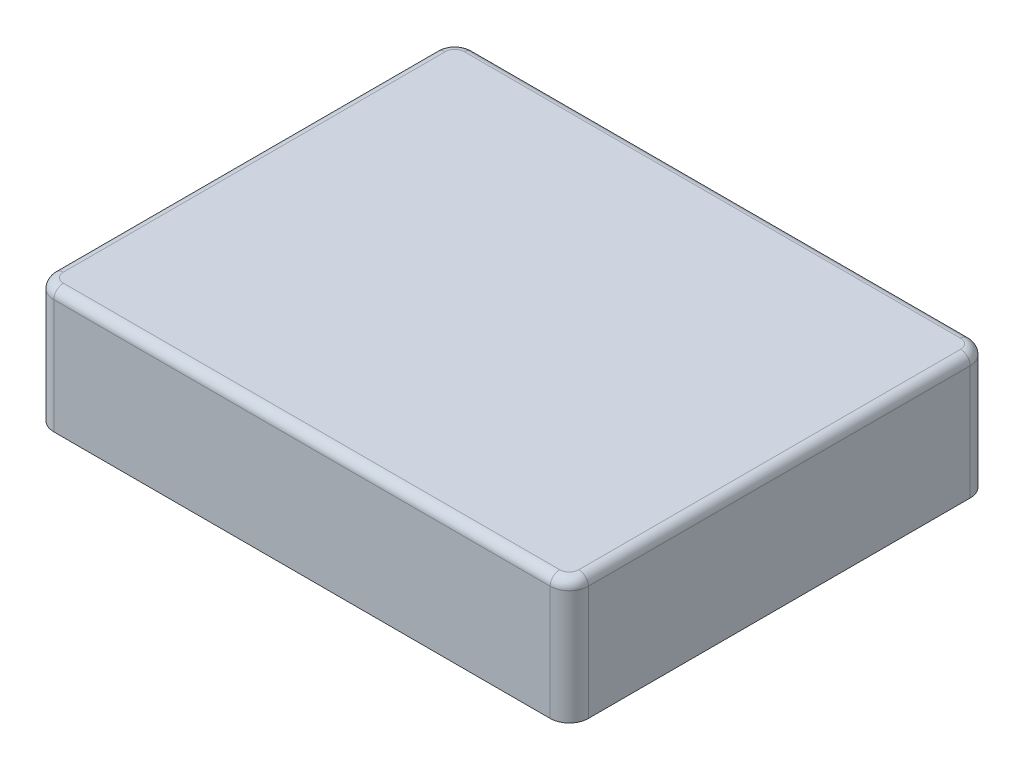
from build123d import *

# Parameters (mm, degrees)
SKETCH1_W           = 56
SKETCH1_H           = 44
BOSS_EXTRUDE1_DEPTH = 13
FILLET1_R           = 1
FILLET2_R           = 2


with BuildPart() as part:
    # Sketch1 → Boss-Extrude1 (new body)
    with BuildSketch(Plane(origin=(0, 0, 0), x_dir=(1, 0, 0), z_dir=(0, 1, 0))):
        Rectangle(SKETCH1_W, SKETCH1_H)
    extrude(amount=BOSS_EXTRUDE1_DEPTH)

    # Fillet1
    fillet1_edges = [part.edges().sort_by_distance(p)[0] for p in [
        (28, 13, 0),
        (0, 13, -22),
        (-28, 13, 0),
        (0, 13, 22),
    ]]
    fillet(fillet1_edges, radius=FILLET1_R)

    # Fillet2
    # the kernel refuses this fillet: 2 mm, written as the material it takes off along each edge
    with BuildSketch(Plane(origin=(26, 13, 20), x_dir=(0, 0, 1), z_dir=(-1, 0, 0))) as fillet2_piece_1:
        with BuildLine():
            CenterArc((1, -1), 1, 0, 90)
            Line((2, -1), (2, 0))
            Line((2, 0), (1, 0))
        make_face()
    revolve(axis=Axis((26, 13, 20), (0, 1, 0)), revolution_arc=90, mode=Mode.SUBTRACT)
    with BuildSketch(Plane(origin=(-26, 13, 20), x_dir=(-1, 0, 0), z_dir=(0, 0, -1))) as fillet2_piece_2:
        with BuildLine():
            CenterArc((1, -1), 1, 0, 90)
            Line((2, -1), (2, 0))
            Line((2, 0), (1, 0))
        make_face()
    revolve(axis=Axis((-26, 13, 20), (0, 1, 0)), revolution_arc=90, mode=Mode.SUBTRACT)
    with BuildSketch(Plane(origin=(26, 13, -20), x_dir=(1, 0, 0), z_dir=(0, 0, 1))) as fillet2_piece_3:
        with BuildLine():
            CenterArc((1, -1), 1, 0, 90)
            Line((2, -1), (2, 0))
            Line((2, 0), (1, 0))
        make_face()
    revolve(axis=Axis((26, 13, -20), (0, 1, 0)), revolution_arc=90, mode=Mode.SUBTRACT)
    with BuildSketch(Plane(origin=(-26, 13, -20), x_dir=(0, 0, -1), z_dir=(1, 0, 0))) as fillet2_piece_4:
        with BuildLine():
            CenterArc((1, -1), 1, 0, 90)
            Line((2, -1), (2, 0))
            Line((2, 0), (1, 0))
        make_face()
    revolve(axis=Axis((-26, 13, -20), (0, 1, 0)), revolution_arc=90, mode=Mode.SUBTRACT)
    with BuildSketch(Plane(origin=(-28, -5, -22), x_dir=(1, 0, 0), z_dir=(0, 1, 0)), Plane(origin=(-28, -5, 22), x_dir=(0, 0, -1), z_dir=(0, 1, 0))) as fillet2_piece_5:
        with BuildLine():
            CenterArc((FILLET2_R, -FILLET2_R), FILLET2_R, 90, 90)
            Line((0, -FILLET2_R), (0, 0))
            Line((0, 0), (FILLET2_R, 0))
        make_face()
    extrude(amount=18, mode=Mode.SUBTRACT)
    with BuildSketch(Plane(origin=(28, -5, -22), x_dir=(-1, 0, 0), z_dir=(0, 1, 0)), Plane(origin=(28, -5, 22), x_dir=(0, 0, -1), z_dir=(0, 1, 0))) as fillet2_piece_6:
        with BuildLine():
            CenterArc((FILLET2_R, FILLET2_R), FILLET2_R, 180, 90)
            Line((0, FILLET2_R), (0, 0))
            Line((0, 0), (FILLET2_R, 0))
        make_face()
    extrude(amount=18, mode=Mode.SUBTRACT)


solid = part.part
